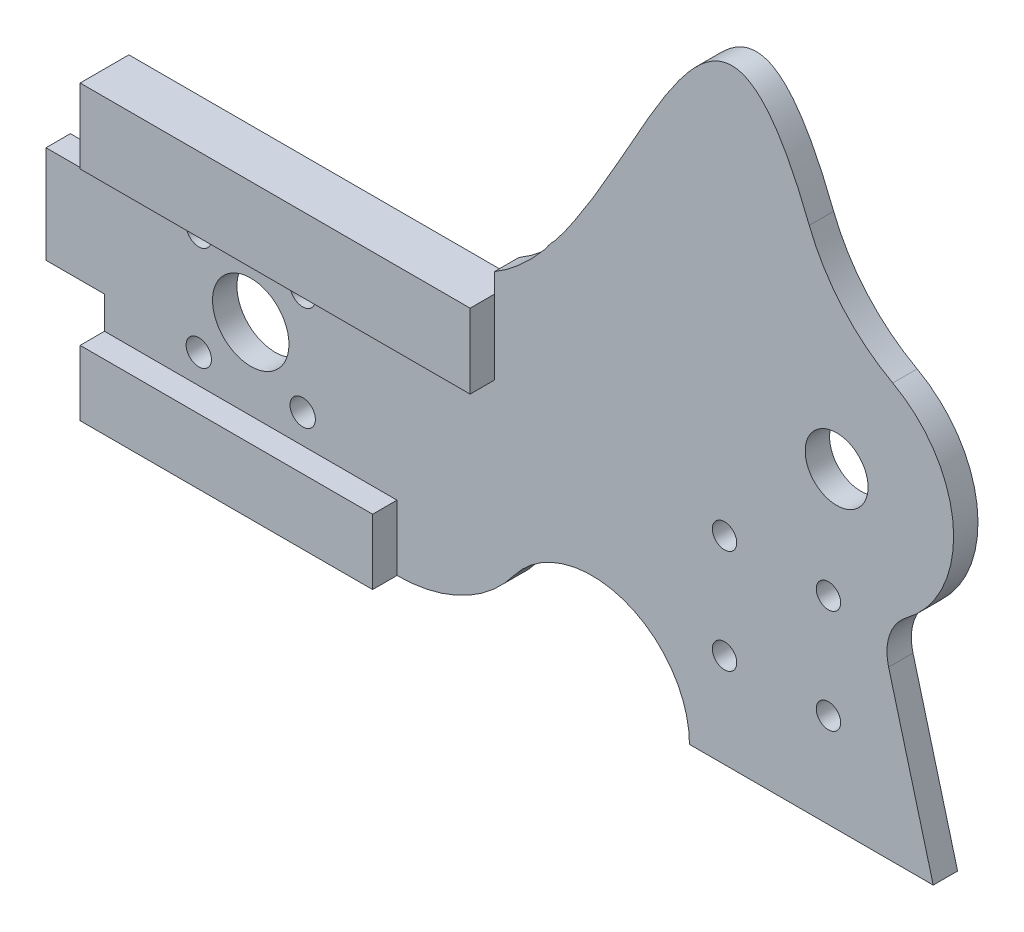
from build123d import *

# Parameters (mm, degrees)
SKETCH1_R           = 4.09575
SKETCH1_R_2         = 1.651
BOSS_EXTRUDE1_DEPTH = 3.175
CUT_EXTRUDE2_DEPTH  = 6.35
SKETCH7_R           = 4.9784
SKETCH7_R_2         = 1.5875
CUT_EXTRUDE3_DEPTH  = 124.96234811
FILLET1_R           = 6.35
SKETCH8_W           = 50.8
SKETCH8_H           = 12.7
CUT_EXTRUDE4_DEPTH  = 50.8
CUT_EXTRUDE5_DEPTH  = 19.304
FILLET6_R           = 6.35
FILLET7_R           = 6.35
FILLET8_R           = 19.05
BOSS_EXTRUDE2_DEPTH = 3.175
FILLET9_R           = 24.13
SKETCH13_W          = 50.8
SKETCH13_H          = 9.69768102
SKETCH13_W_2        = 38.1
SKETCH13_H_2        = 8.504610511
BOSS_EXTRUDE3_DEPTH = 6.35


with BuildPart() as part:
    # Sketch1 → Boss-Extrude1 (new body)
    with BuildSketch(Plane.XY):
        with BuildLine():
            Line((0, 0), (107.95, 0))
            Line((107.95, 0), (100.9362606, 26.175631792))
            Line((100.9362606, 26.175631792), (100.868755024, 26.427566033))
            ThreePointArc((100.868755024, 26.427566033), (110.348359368, 43.438223217), (95.367453293, 55.88))
            Line((95.367453293, 55.88), (0, 38.1))
            Line((0, 38.1), (0, 25.4))
            Line((0, 25.4), (-7.62, 25.4))
            Line((-7.62, 25.4), (-7.62, 12.7))
            Line((-7.62, 12.7), (0, 12.7))
            Line((0, 12.7), (0, 0))
        make_face()
        with Locations((95.367453293, 40.64)):
            Circle(SKETCH1_R, mode=Mode.SUBTRACT)
        with Locations((25.817011896, 25.817011896)):
            Circle(SKETCH1_R_2, mode=Mode.SUBTRACT)
        with Locations((25.817011896, 12.282988104)):
            Circle(SKETCH1_R_2, mode=Mode.SUBTRACT)
        with Locations((12.282988104, 12.282988104)):
            Circle(SKETCH1_R_2, mode=Mode.SUBTRACT)
        with Locations((12.282988104, 25.817011896)):
            Circle(SKETCH1_R_2, mode=Mode.SUBTRACT)
    extrude(amount=BOSS_EXTRUDE1_DEPTH)

    # Sketch6 → Cut-Extrude2 (cut)
    with BuildSketch(Plane.XY.offset(3.175)):
        with BuildLine():
            Line((50.8, 0), (76.2, 0))
            ThreePointArc((76.2, 0), (63.5, 12.7), (50.8, 0))
        make_face()
    extrude(amount=-CUT_EXTRUDE2_DEPTH, mode=Mode.SUBTRACT)

    # Sketch7 → Cut-Extrude3 (cut, through all)
    with BuildSketch(Plane.XY.offset(3.175)):
        with Locations((19.05, 19.05)):
            Circle(SKETCH7_R)
        with Locations((80.766582748, 12.282988104)):
            Circle(SKETCH7_R_2)
        with Locations((94.299702748, 12.282988104)):
            Circle(SKETCH7_R_2)
        with Locations((80.766582748, 25.817011896)):
            Circle(SKETCH7_R_2)
        with Locations((94.299702748, 25.817011896)):
            Circle(SKETCH7_R_2)
    extrude(amount=-CUT_EXTRUDE3_DEPTH, mode=Mode.SUBTRACT)

    # Fillet1
    fillet1_edges = [part.edges().sort_by_distance(p)[0] for p in [
        (100.868755024, 26.427566033, 1.5875),
    ]]
    fillet(fillet1_edges, radius=FILLET1_R)

    # Sketch8 → Cut-Extrude4 (cut)
    with BuildSketch(Plane.XY.offset(3.175)):
        with Locations((25.4, 44.45)):
            Rectangle(SKETCH8_W, SKETCH8_H)
    extrude(amount=-CUT_EXTRUDE4_DEPTH, mode=Mode.SUBTRACT)

    # Sketch9 → Cut-Extrude5 (cut)
    with BuildSketch(Plane.XY.offset(3.175)):
        Polygon((50.8, 47.57098794), (50.8, 40.64), (57.15, 40.64), (57.15, 48.754861432), align=None)
    extrude(amount=-CUT_EXTRUDE5_DEPTH, mode=Mode.SUBTRACT)

    # Fillet6
    fillet6_edges = [part.edges().sort_by_distance(p)[0] for p in [
        (57.15, 40.64, 1.5875),
    ]]
    fillet(fillet6_edges, radius=FILLET6_R - 0.0001)  # a hair under: the kernel refuses the full size

    # Fillet7
    fillet7_edges = [part.edges().sort_by_distance(p)[0] for p in [
        (57.15, 48.754861432, 1.5875),
    ]]
    fillet(fillet7_edges, radius=FILLET7_R)

    # Fillet8
    fillet8_edges = [part.edges().sort_by_distance(p)[0] for p in [
        (50.8, 0, 1.5875),
    ]]
    fillet(fillet8_edges, radius=FILLET8_R)

    # Sketch12 → Boss-Extrude2 (add)
    with BuildSketch(Plane.XY.offset(3.175)):
        with BuildLine():
            Line((50.8, 40.64), (85.027112904, 40.64))
            Line((85.027112904, 40.64), (95.367453293, 55.88))
            add(Edge.make_bspline(
                [(50.8, 40.64), (70.777788932, 52.178803671), (78.594281742, 111.543427795), (95.367453293, 55.88)],
                knots=[0, 0, 0, 0, 1, 1, 1, 1], degree=3))
        make_face()
    extrude(amount=-BOSS_EXTRUDE2_DEPTH)

    # Fillet9
    fillet9_edges = [part.edges().sort_by_distance(p)[0] for p in [
        (95.367453293, 55.88, 1.5875),
    ]]
    fillet(fillet9_edges, radius=FILLET9_R)

    # Sketch13 → Boss-Extrude3 (add)
    with BuildSketch(Plane(origin=(0, 0, 0), x_dir=(-1, 0, 0), z_dir=(0, 0, -1))):
        with Locations((-25.4, 33.25115949)):
            Rectangle(SKETCH13_W, SKETCH13_H)
        with Locations((-19.05, 4.252305256)):
            Rectangle(SKETCH13_W_2, SKETCH13_H_2)
    extrude(amount=-BOSS_EXTRUDE3_DEPTH)


solid = part.part
